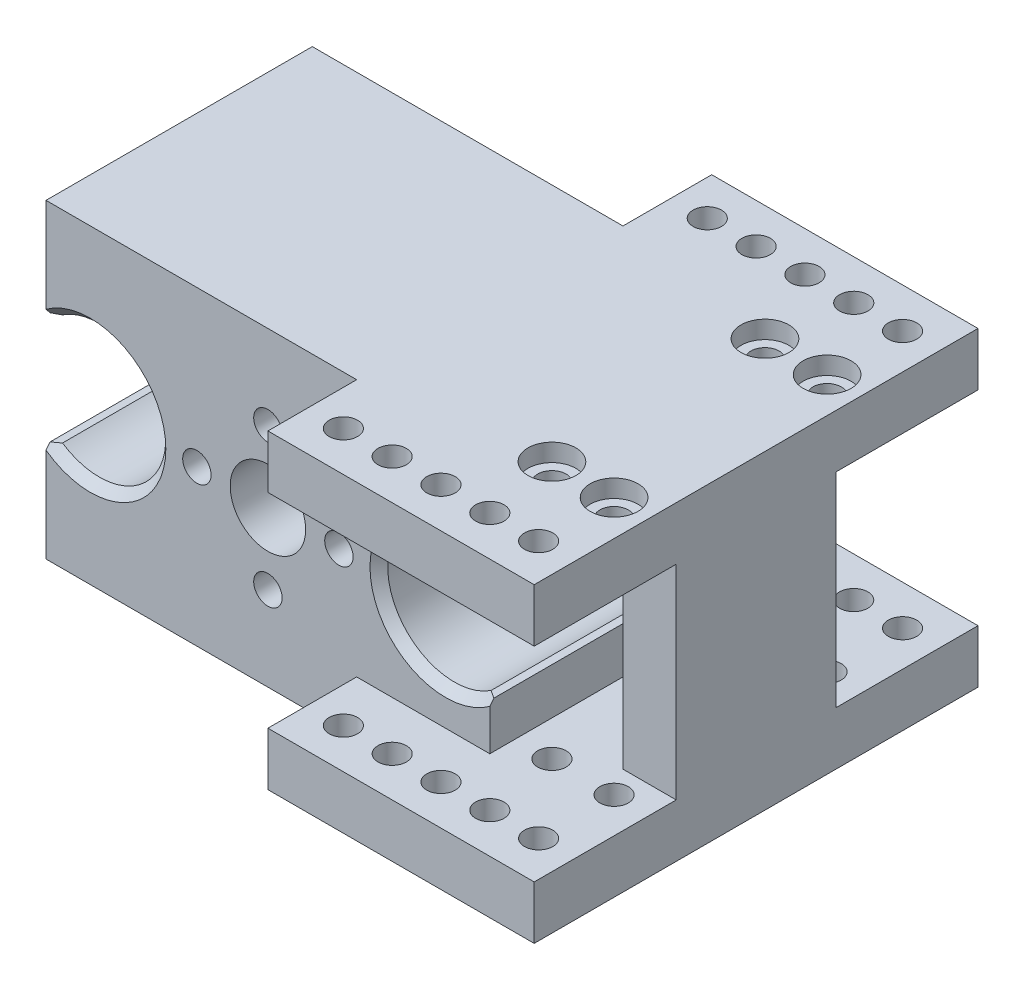
from build123d import *

# Parameters (mm, degrees)
SKETCH_1_W               = 50
SKETCH_1_H               = 35
EXTRUDE_1_DEPTH          = 30
HOLE_WIZARD_394_D        = 8.5
HOLE_WIZARD_498_D        = 3.2
HOLE_WIZARD_652_D        = 15
CHAMFER_1_SIZE           = 1
CHAMFER_1_SIZE_2         = 0.708203932
SKETCH_9_W               = 30
SKETCH_9_H               = 6
EXTRUDE_3_DEPTH          = 15
SKETCH_10_W              = 6
SKETCH_10_H              = 23
EXTRUDE_4_DEPTH          = 9
HOLE_WIZARD_1_D          = 3.2
HOLE_WIZARD_1_DEPTH      = 6
MIRROR_2_COPY_1_D        = 3.2
MIRROR_2_COPY_1_DEPTH    = 6
SKETCH_15_W              = 30
SKETCH_15_H              = 6
EXTRUDE_6_DEPTH          = 10
HOLE_WIZARD_2_D          = 3.2
MIRROR_5_COPY_1_D        = 3.2
MIRROR_6_COPY_1_D        = 3.2
MIRROR_6_COPY_2_SKETCH_W = 30
MIRROR_6_COPY_2_SKETCH_H = 6
MIRROR_6_COPY_2_DEPTH    = 10
MIRROR_6_COPY_3_D        = 3.2
MIRROR_6_COPY_4_D        = 3.2
HOLE_WIZARD_3_D          = 5.4
HOLE_WIZARD_3_DEPTH      = 2
HOLE_WIZARD_4_D          = 12
HOLE_WIZARD_4_DEPTH      = 12


with BuildPart() as part:
    # 草图1 → 凸台-拉伸1 (new body)
    with BuildSketch(Plane.XY):
        Rectangle(SKETCH_1_W, SKETCH_1_H)
    extrude(amount=EXTRUDE_1_DEPTH)

    # Hole Wizard 394 (through all)
    with Locations(Plane.XY.offset(30)):
        with Locations((0, 0)):
            Hole(HOLE_WIZARD_394_D / 2)

    # Hole Wizard 498 (through all)
    with Locations(Plane.XY.offset(30)):
        with Locations((8, 0), (0, 8), (-8, 0), (0, -8)):
            Hole(HOLE_WIZARD_498_D / 2)

    # Hole Wizard 652 (through all)
    with Locations(Plane.XY.offset(30)):
        with Locations((20, 0), (-20, 0)):
            Hole(HOLE_WIZARD_652_D / 2)

    # 倒角1
    # the kernel refuses this chamfer: 1, 0.708203932 mm, written as the material it takes off along each edge
    with BuildSketch(Plane(origin=(-20, 0, 0), x_dir=(-0.8790200859122482, 0.4767847402789059, 0), z_dir=(-0.4767847402789059, -0.8790200859122482, 0))) as chamfer_1_piece_1:
        Polygon((7.5, -CHAMFER_1_SIZE), (7.5 + CHAMFER_1_SIZE, 0), (7.5, 0), align=None)
    revolve(axis=Axis((-20, 0, 0), (0, 0, -1)), revolution_arc=303.048763938, mode=Mode.SUBTRACT)
    with BuildSketch(Plane(origin=(-20, 0, 30), x_dir=(-0.879020085912248, 0.47678474027890627, 0), z_dir=(-0.47678474027890627, -0.879020085912248, 0))) as chamfer_1_piece_2:
        Polygon((7.5 + CHAMFER_1_SIZE, 0), (7.5, CHAMFER_1_SIZE), (7.5, 0), align=None)
    revolve(axis=Axis((-20, 0, 30), (0, 0, -1)), revolution_arc=303.048763938, mode=Mode.SUBTRACT)
    with BuildSketch(Plane(origin=(20, 0, 30), x_dir=(0.879020085912248, -0.4767847402789061, 0), z_dir=(0.4767847402789061, 0.879020085912248, 0))) as chamfer_1_piece_3:
        Polygon((7.5 + CHAMFER_1_SIZE, 0), (7.5, CHAMFER_1_SIZE), (7.5, 0), align=None)
    revolve(axis=Axis((20, 0, 30), (0, 0, -1)), revolution_arc=303.048763938, mode=Mode.SUBTRACT)
    with BuildSketch(Plane(origin=(20, 0, 0), x_dir=(0.8790200859122481, 0.476784740278906, 0), z_dir=(0.476784740278906, -0.8790200859122481, 0))) as chamfer_1_piece_4:
        Polygon((7.5, CHAMFER_1_SIZE), (7.5 + CHAMFER_1_SIZE, 0), (7.5, 0), align=None)
    revolve(axis=Axis((20, 0, 0), (0, 0, 1)), revolution_arc=303.048763938, mode=Mode.SUBTRACT)
    with BuildSketch(Plane(origin=(-25, 5.590169944, 32.778051389), x_dir=(0.7914486393779661, 0.611235675682274, 0), z_dir=(0, 0, -1)), Plane(origin=(25, -5.590169944, 32.778051389), x_dir=(-0.7914486393779661, -0.611235675682274, 0), z_dir=(0, 0, -1))) as chamfer_1_piece_5:
        with BuildLine():
            Line((1.080663788, 0), (CHAMFER_1_SIZE_2 * 0.611235676113, -CHAMFER_1_SIZE_2 * 0.791448639936))
            Line((CHAMFER_1_SIZE_2 * 0.611235676113, -CHAMFER_1_SIZE_2 * 0.791448639936), (0, 0))
            ThreePointArc((0, 0), (0.555522087, -0.019473843), (1.080663788, 0))
        make_face()
    extrude(amount=35.556102778, mode=Mode.SUBTRACT)
    with BuildSketch(Plane(origin=(-25, -5.590169944, 32.778051389), x_dir=(0.7914486393779665, -0.6112356756822735, 0), z_dir=(0, 0, -1))) as chamfer_1_piece_6:
        with BuildLine():
            Line((1.080663788, 0), (CHAMFER_1_SIZE_2 * 0.611235676113, CHAMFER_1_SIZE_2 * 0.791448639936))
            Line((CHAMFER_1_SIZE_2 * 0.611235676113, CHAMFER_1_SIZE_2 * 0.791448639936), (0, 0))
            ThreePointArc((0, 0), (0.555522087, 0.019473843), (1.080663788, 0))
        make_face()
    extrude(amount=35.556102778, mode=Mode.SUBTRACT)
    with BuildSketch(Plane(origin=(25, 5.590169944, 32.778051389), x_dir=(0, 1, 0), z_dir=(0, 0, -1))) as chamfer_1_piece_7:
        with BuildLine():
            Line((CHAMFER_1_SIZE_2, 0), (0.660540261, -0.855289885))
            ThreePointArc((0.660540261, -0.855289885), (0.354967464, -0.427764092), (0, 0))
            Line((0, 0), (CHAMFER_1_SIZE_2, 0))
        make_face()
    extrude(amount=35.556102778, mode=Mode.SUBTRACT)

    # 草图9 → 凸台-拉伸3 (add)
    with BuildSketch(Plane(origin=(25, 0, 0), x_dir=(0, 0, -1), z_dir=(1, 0, 0))):
        with Locations((-15, 14.5)):
            Rectangle(SKETCH_9_W, SKETCH_9_H)
        with Locations((-15, -14.5)):
            Rectangle(SKETCH_9_W, SKETCH_9_H)
    extrude(amount=EXTRUDE_3_DEPTH)

    # 草图10 → 凸台-拉伸4 (add, symmetric)
    with BuildSketch(Plane.XY.offset(15)):
        with Locations((37, 0)):
            Rectangle(SKETCH_10_W, SKETCH_10_H)
    extrude(amount=EXTRUDE_4_DEPTH, both=True)

    # 孔1
    with Locations(Plane(origin=(0, 11.5, 0), x_dir=(-1, 0, 0), z_dir=(0, -1, 0))):
        with Locations((-36, -3), (-29, -3)):
            hole_wizard_1 = Hole(HOLE_WIZARD_1_D / 2, depth=HOLE_WIZARD_1_DEPTH)

    # 镜向1: 孔1 across plane
    add(hole_wizard_1.mirror(Plane.XY.offset(15)), mode=Mode.SUBTRACT)

    # 镜向2: 孔1 across plane
    add(hole_wizard_1.mirror(Plane(origin=(0, 0, 0), x_dir=(0, 0, 1), z_dir=(0, -1, 0))), mode=Mode.SUBTRACT)

    # 镜向2 copy 1
    with Locations(Plane(origin=(0, -11.5, 30), x_dir=(-1, 0, 0), z_dir=(0, 1, 0))):
        with Locations((-36, -3), (-29, -3)):
            Hole(MIRROR_2_COPY_1_D / 2, depth=MIRROR_2_COPY_1_DEPTH)

    # 草图15 → 凸台-拉伸6 (add)
    with BuildSketch(Plane(origin=(0, 0, 0), x_dir=(-1, 0, 0), z_dir=(0, 0, -1))):
        with Locations((-25, 14.5)):
            Rectangle(SKETCH_15_W, SKETCH_15_H)
    extrude_6 = extrude(amount=EXTRUDE_6_DEPTH)

    # 孔2 (through all)
    with Locations(Plane(origin=(0, 11.5, 0), x_dir=(-1, 0, 0), z_dir=(0, -1, 0))):
        with Locations((-19.5, 5.5), (-14, 5.5), (-25, 5.5)):
            hole_wizard_2 = Hole(HOLE_WIZARD_2_D / 2)

    # 镜向4: 孔2 across plane
    add(hole_wizard_2.mirror(Plane(origin=(25, 0, 0), x_dir=(0, 0, 1), z_dir=(1, 0, 0))), mode=Mode.SUBTRACT)

    # 镜向5: 凸台-拉伸6, 孔2 across plane
    add(extrude_6.mirror(Plane.XY.offset(15)))
    add(hole_wizard_2.mirror(Plane.XY.offset(15)), mode=Mode.SUBTRACT)

    # 镜向5 copy 1 (through all)
    with Locations(Plane(origin=(50, 11.5, 30), x_dir=(1, 0, 0), z_dir=(0, -1, 0))):
        with Locations((-19.5, 5.5), (-14, 5.5), (-25, 5.5)):
            Hole(MIRROR_5_COPY_1_D / 2)

    # 镜向6: 凸台-拉伸6, 孔2 across plane
    add(extrude_6.mirror(Plane(origin=(0, 0, 0), x_dir=(0, 0, 1), z_dir=(0, -1, 0))))
    add(hole_wizard_2.mirror(Plane(origin=(0, 0, 0), x_dir=(0, 0, 1), z_dir=(0, -1, 0))), mode=Mode.SUBTRACT)

    # 镜向6 copy 1 (through all)
    with Locations(Plane(origin=(50, -11.5, 0), x_dir=(1, 0, 0), z_dir=(0, 1, 0))):
        with Locations((-19.5, 5.5), (-14, 5.5), (-25, 5.5)):
            Hole(MIRROR_6_COPY_1_D / 2)

    # 镜向6 copy 2 sketch → 镜向6 copy 2 (add)
    with BuildSketch(Plane(origin=(0, 0, 30), x_dir=(-1, 0, 0), z_dir=(0, 0, 1))):
        with Locations((-25, 14.5)):
            Rectangle(MIRROR_6_COPY_2_SKETCH_W, MIRROR_6_COPY_2_SKETCH_H)
    extrude(amount=MIRROR_6_COPY_2_DEPTH)

    # 镜向6 copy 3 (through all)
    with Locations(Plane(origin=(0, -11.5, 30), x_dir=(-1, 0, 0), z_dir=(0, 1, 0))):
        with Locations((-19.5, 5.5), (-14, 5.5), (-25, 5.5)):
            Hole(MIRROR_6_COPY_3_D / 2)

    # 镜向6 copy 4 (through all)
    with Locations(Plane(origin=(50, -11.5, 30), x_dir=(1, 0, 0), z_dir=(0, 1, 0))):
        with Locations((-19.5, -5.5), (-14, -5.5), (-25, -5.5)):
            Hole(MIRROR_6_COPY_4_D / 2)

    # 孔3
    with Locations(Plane(origin=(0, -17.5, 0), x_dir=(-1, 0, 0), z_dir=(0, -1, 0))):
        with Locations((-29, -3), (-36, -3), (-36, -27), (-29, -27)):
            hole_wizard_3 = Hole(HOLE_WIZARD_3_D / 2, depth=HOLE_WIZARD_3_DEPTH)

    # 镜向7: 孔3 across plane
    add(hole_wizard_3.mirror(Plane(origin=(0, 0, 0), x_dir=(0, 0, 1), z_dir=(0, -1, 0))), mode=Mode.SUBTRACT)

    # 孔4
    with Locations(Plane(origin=(0, 0, 0), x_dir=(-1, 0, 0), z_dir=(0, 0, -1))):
        with Locations((0, 0)):
            Hole(HOLE_WIZARD_4_D / 2, depth=HOLE_WIZARD_4_DEPTH)


solid = part.part
